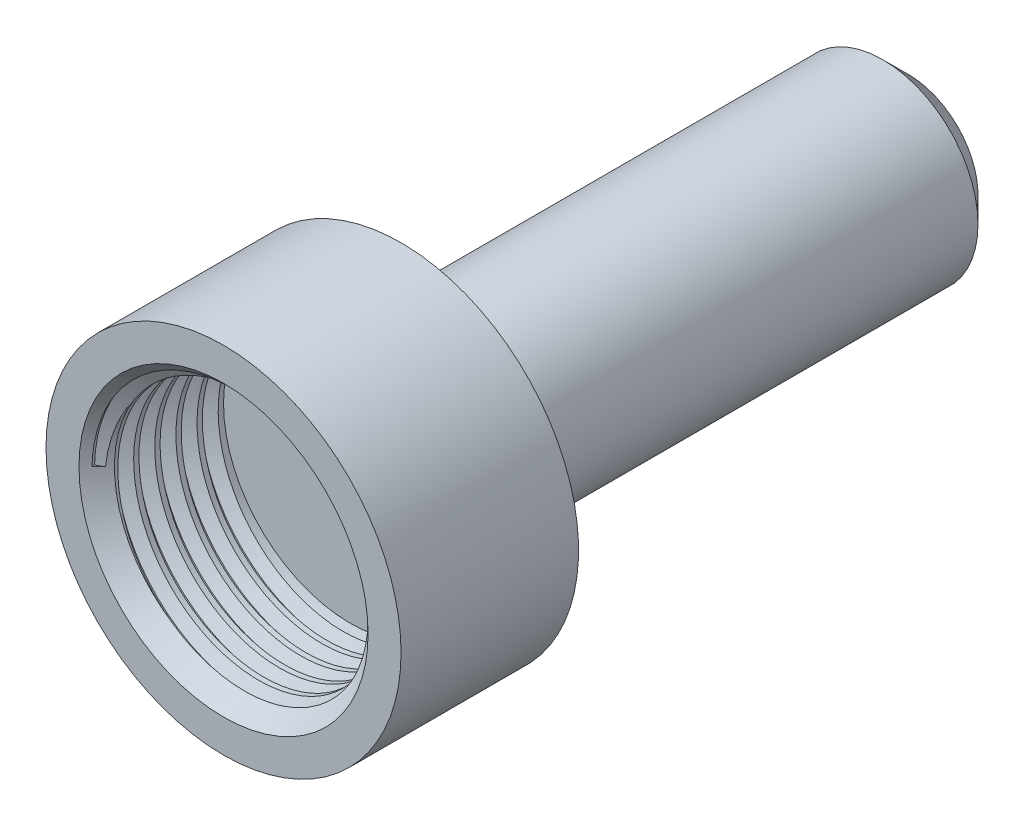
from build123d import *

# Parameters (mm, degrees)
SKETCH1_R           = 8.89
SKETCH1_R_2         = 6.35
BOSS_EXTRUDE1_DEPTH = 6.35
BOSS_EXTRUDE2_START = 2.54
SKETCH2_R           = 8.89
BOSS_EXTRUDE2_DEPTH = 2.54
SKETCH3_R           = 4.7625
BOSS_EXTRUDE3_DEPTH = 25.4
FILLET1_R           = 2.54
CHAMFER1_SIZE       = 1.27
THREAD1_PITCH       = 1.058333333


with BuildPart() as part:
    # Sketch1 → Boss-Extrude1 (new body)
    with BuildSketch(Plane.XY):
        Circle(SKETCH1_R)
        Circle(SKETCH1_R_2, mode=Mode.SUBTRACT)
    extrude(amount=BOSS_EXTRUDE1_DEPTH)

    # Sketch2 → Boss-Extrude2 (add)
    with BuildSketch(Plane(origin=(0, 0, 0), x_dir=(-1, 0, 0), z_dir=(0, 0, -1)).offset(BOSS_EXTRUDE2_START)):
        Circle(SKETCH2_R)
    extrude(amount=-BOSS_EXTRUDE2_DEPTH)

    # Sketch3 → Boss-Extrude3 (add)
    with BuildSketch(Plane(origin=(0, 0, -2.54), x_dir=(-1, 0, 0), z_dir=(0, 0, -1))):
        Circle(SKETCH3_R)
    extrude(amount=BOSS_EXTRUDE3_DEPTH)

    # Fillet1
    fillet1_edges = [part.edges().sort_by_distance(p)[0] for p in [
        (4.7625, 0, -2.54),
    ]]
    fillet(fillet1_edges, radius=FILLET1_R)

    # Chamfer1
    chamfer1_edges = [part.edges().sort_by_distance(p)[0] for p in [
        (4.7625, 0, -27.94),
    ]]
    chamfer(chamfer1_edges, length=CHAMFER1_SIZE)

    # Thread1: the profile of Thread Profile1 profile screwed along a right-hand helix of 5.52 turns, 8 arcs to a turn; built about Z, then put on its axis
    thread1_z = Axis((0, 0, 0), (0, 0, 1))
    thread1_corners = [(6.3497, 0, -0.000173205), (6.922839718, 0, 0.330729165), (6.922839718, 0, 0.463020832), (6.3497, 0, 0.793923202)]
    with BuildLine(mode=Mode.PRIVATE) as thread1_profile:
        Line(thread1_corners[0], thread1_corners[1])
        Line(thread1_corners[1], thread1_corners[2])
        Line(thread1_corners[2], thread1_corners[3])
        Line(thread1_corners[3], thread1_corners[0])
    thread1_cap = Face(thread1_profile.wire())
    thread1_turn_angles = [0, 22.5, 45, 67.5, 90, 112.5, 135, 157.5, 180, 202.5, 225, 247.5, 270, 292.5, 315, 337.5, 360]
    thread1_turn_weights = [1, 0.9238795325112867, 1, 0.9238795325112867, 1, 0.9238795325112867, 1, 0.9238795325112867, 1, 0.9238795325112867, 1, 0.9238795325112867, 1, 0.9238795325112867, 1, 0.9238795325112867, 1]
    thread1_turn_rails = [Edge.make_bspline([Vector(p[0], p[1], 0).rotate(thread1_z, thread1_turn_angles[k]) / thread1_turn_weights[k] + Vector(0, 0, p[2] + THREAD1_PITCH * thread1_turn_angles[k] / 360) for k in range(17)], [0, 0, 0, 1, 1, 2, 2, 3, 3, 4, 4, 5, 5, 6, 6, 7, 7, 8, 8, 8], 2, thread1_turn_weights) for p in thread1_corners]
    thread1_turn_sides = [Face.make_surface_from_curves(thread1_turn_rails[p[0]], thread1_turn_rails[p[1]]) for p in [(0, 1), (1, 2), (2, 3), (3, 0)]]
    thread1_last_angles = [1800, 1822.5, 1845, 1867.5, 1890, 1912.5, 1935, 1957.5, 1980, 1983.6, 1987.2]
    thread1_last_weights = [1, 0.9238795325112867, 1, 0.9238795325112867, 1, 0.9238795325112867, 1, 0.9238795325112867, 1, 0.9980267284282714, 1]
    thread1_last_rails = [Edge.make_bspline([Vector(p[0], p[1], 0).rotate(thread1_z, thread1_last_angles[k]) / thread1_last_weights[k] + Vector(0, 0, p[2] + THREAD1_PITCH * thread1_last_angles[k] / 360) for k in range(11)], [0, 0, 0, 1, 1, 2, 2, 3, 3, 4, 4, 5, 5, 5], 2, thread1_last_weights) for p in thread1_corners]
    thread1_last_sides = [Face.make_surface_from_curves(thread1_last_rails[p[0]], thread1_last_rails[p[1]]) for p in [(0, 1), (1, 2), (2, 3), (3, 0)]]
    thread1 = Plane(origin=(0, 0, 6.35), x_dir=(-1, 0, 0), z_dir=(0, 0, -1)) * Solid(Shell([*[p.moved(Location((0, 0, THREAD1_PITCH * i))) for i in range(5) for p in thread1_turn_sides], *thread1_last_sides, thread1_cap, thread1_cap.rotate(thread1_z, 1987.2).moved(Location((0, 0, THREAD1_PITCH * 1987.2 / 360)))]))
    add(thread1, mode=Mode.SUBTRACT)

    # Sketch7 → Cut-Revolve1 (revolve, cut)
    with BuildSketch(Plane(origin=(0, 0, 0), x_dir=(0, 0, -1), z_dir=(1, 0, 0)), mode=Mode.PRIVATE) as cut_revolve1_sk:
        Polygon((-4.953, -5.842), (-6.477, -7.366), (-6.477, -5.842), align=None)
    revolve(cut_revolve1_sk.sketch.rotate(Axis((0, 0, 0), (0, 0, 1)), 270), axis=Axis((0, 0, 0), (0, 0, 1)), mode=Mode.SUBTRACT)


solid = part.part
